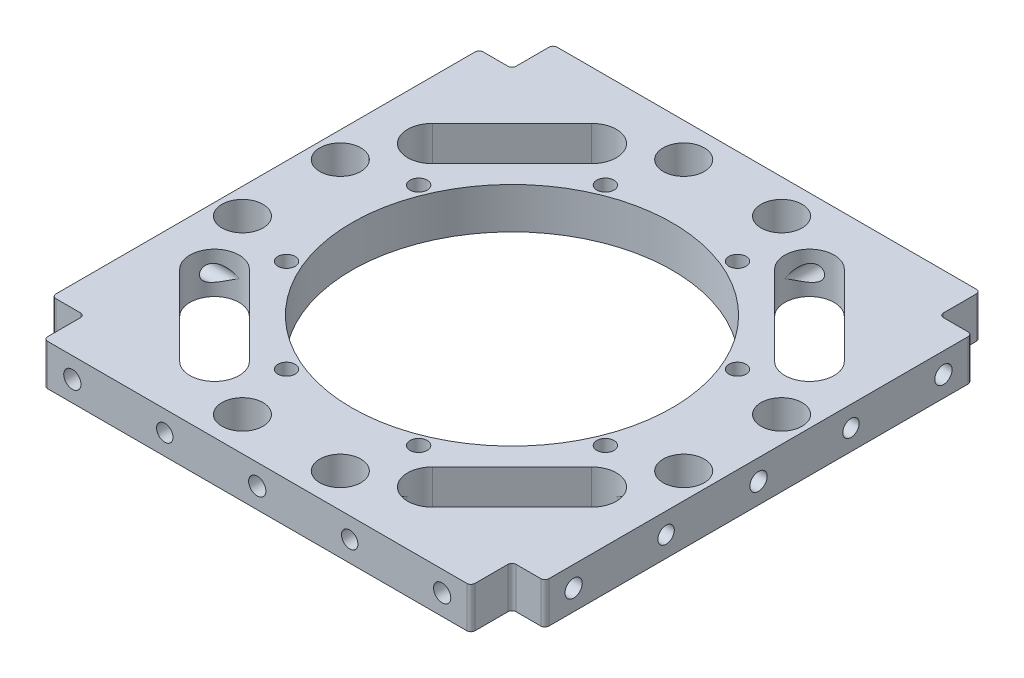
from build123d import *

# Parameters (mm, degrees)
SKETCH_1_W                  = 120
SKETCH_1_H                  = 124
SKETCH_1_R                  = 39
EXTRUDE_1_DEPTH             = 5
SKETCH_2_R                  = 2.1
CUT_EXTRUDE_1_DEPTH         = 87.856203002
PATTERN_CIRCULAR_1_COUNT    = 8
SKETCH_3_R                  = 1.5
CUT_EXTRUDE_2_DEPTH         = 15
SKETCH_4_R                  = 1.5
CUT_EXTRUDE_5_DEPTH         = 10
HOLE_WIZARD_M5_1_AT_2_COUNT = 2
HOLE_WIZARD_M5_1_AT_2_PITCH = 45
HOLE_WIZARD_M5_1_AT_3_COUNT = 2
HOLE_WIZARD_M5_1_AT_3_PITCH = 90
HOLE_WIZARD_M5_2_AT_2_COUNT = 2
HOLE_WIZARD_M5_2_AT_2_PITCH = 45
HOLE_WIZARD_M5_2_AT_3_COUNT = 2
HOLE_WIZARD_M5_2_AT_3_PITCH = 90
SKETCH_10_W                 = 8
SKETCH_10_H                 = 10
CUT_EXTRUDE_6_DEPTH         = 87.856203002
HOLE_WIZARD_M5_3_D          = 4.2
CUT_EXTRUDE_7_DEPTH         = 87.856203002
PATTERN_CIRCULAR_2_COUNT    = 4
SKETCH_13_R                 = 5
CUT_EXTRUDE_8_DEPTH         = 87.856203002
PATTERN_CIRCULAR_3_COUNT    = 4
FILLET_1_R                  = 1
F_4_0MM_1_REACH             = 137.163
F_4_0MM_1_BORE_R            = 2
F_4_0MM_START               = -62
F_4_0MM_2_OUTLINE_R         = 2
F_4_0MM_2_DEPTH             = 16.100653699


# Read off the part's stored shape, not the designer's step: Ø4.0mm 暗销孔2
with BuildPart() as part:
    # 草图1 → 凸台-拉伸1 (new, symmetric)
    with BuildSketch(Plane(origin=(0, 0, 0), x_dir=(1, 0, 0), z_dir=(0, 1, 0))):
        Rectangle(SKETCH_1_W, SKETCH_1_H)
        with Locations(Location((0, 0, 0), (0, 0, 270))):
            Circle(SKETCH_1_R, mode=Mode.SUBTRACT)
    extrude(amount=EXTRUDE_1_DEPTH, both=True)

    # 草图2 → 切除-拉伸1 (cut, through all)
    with BuildSketch(Plane(origin=(0, 5, 0), x_dir=(1, 0, 0), z_dir=(0, 1, 0))):
        with Locations(Location((-16.072704159, 38.802940365, 0), (0, 0, 270))):
            Circle(SKETCH_2_R)
    cut_extrude_1 = extrude(amount=-CUT_EXTRUDE_1_DEPTH, mode=Mode.SUBTRACT)

    # 阵列(圆周)1: 切除-拉伸1 ×8 about axis
    pattern_circular_1_axis = Axis((0, 0, 0), (0, 1, 0))
    for i in range(1, PATTERN_CIRCULAR_1_COUNT):
        add(cut_extrude_1.rotate(pattern_circular_1_axis, i * 360 / PATTERN_CIRCULAR_1_COUNT), mode=Mode.SUBTRACT)

    # 草图3 → 切除-拉伸2 (cut)
    with BuildSketch(Plane(origin=(60, 0, 0), x_dir=(0, 0, -1), z_dir=(1, 0, 0))):
        with Locations((-45, 0)):
            Circle(SKETCH_3_R)
        Circle(SKETCH_3_R)
        with Locations((45, 0)):
            Circle(SKETCH_3_R)
    cut_extrude_2 = extrude(amount=-CUT_EXTRUDE_2_DEPTH, mode=Mode.SUBTRACT)

    # 草图4 → 切除-拉伸5 (cut)
    with BuildSketch(Plane(origin=(0, 0, -62), x_dir=(-1, 0, 0), z_dir=(0, 0, -1))):
        with Locations((-45, 0)):
            Circle(SKETCH_4_R)
        Circle(SKETCH_4_R)
        with Locations((45, 0)):
            Circle(SKETCH_4_R)
    cut_extrude_5 = extrude(amount=-CUT_EXTRUDE_5_DEPTH, mode=Mode.SUBTRACT)

    # 草图7 → M5 螺纹孔1 (revolve, cut)
    with BuildSketch(Plane(origin=(60, 0, -45), x_dir=(0, 0, -1), z_dir=(0, 1, 0))):
        Polygon((0, 0), (0, 18.6618073), (2.1, 17.4), (2.1, 0), align=None)
    hole_wizard_m5_1 = revolve(axis=Axis((66.35, 0, -45), (-1, 0, 0)), mode=Mode.SUBTRACT)

    # M5 螺纹孔1 at 2: M5 螺纹孔1 ×2
    with Locations(*[(0, 0, i * HOLE_WIZARD_M5_1_AT_2_PITCH) for i in range(1, HOLE_WIZARD_M5_1_AT_2_COUNT)]):
        add(hole_wizard_m5_1, mode=Mode.SUBTRACT)

    # M5 螺纹孔1 at 3: M5 螺纹孔1 ×2
    with Locations(*[(0, 0, i * HOLE_WIZARD_M5_1_AT_3_PITCH) for i in range(1, HOLE_WIZARD_M5_1_AT_3_COUNT)]):
        add(hole_wizard_m5_1, mode=Mode.SUBTRACT)

    # 草图9 → M5 螺纹孔2 (revolve, cut)
    with BuildSketch(Plane(origin=(45, 0, -62), x_dir=(0, 1, 0), z_dir=(1, 0, 0))):
        Polygon((0, 0), (0, 13.6618073), (2.1, 12.4), (2.1, 0), align=None)
    hole_wizard_m5_2 = revolve(axis=Axis((45, 0, -68.35), (0, 0, 1)), mode=Mode.SUBTRACT)

    # M5 螺纹孔2 at 2: M5 螺纹孔2 ×2
    with Locations(*[(-i * HOLE_WIZARD_M5_2_AT_2_PITCH, 0, 0) for i in range(1, HOLE_WIZARD_M5_2_AT_2_COUNT)]):
        add(hole_wizard_m5_2, mode=Mode.SUBTRACT)

    # M5 螺纹孔2 at 3: M5 螺纹孔2 ×2
    with Locations(*[(-i * HOLE_WIZARD_M5_2_AT_3_PITCH, 0, 0) for i in range(1, HOLE_WIZARD_M5_2_AT_3_COUNT)]):
        add(hole_wizard_m5_2, mode=Mode.SUBTRACT)

    # 镜向1: 切除-拉伸2, M5 螺纹孔1 across plane
    add(cut_extrude_2.mirror(Plane(origin=(0, 0, 0), x_dir=(0, 0, 1), z_dir=(1, 0, 0))), mode=Mode.SUBTRACT)
    add(hole_wizard_m5_1.mirror(Plane(origin=(0, 0, 0), x_dir=(0, 0, 1), z_dir=(1, 0, 0))), mode=Mode.SUBTRACT)

    # 镜向1 copy 1 sketch → 镜向1 copy 1 (revolve, cut)
    with BuildSketch(Plane(origin=(-60, 0, 0), x_dir=(0, 0, -1), z_dir=(0, 1, 0))):
        Polygon((0, 0), (0, -18.6618073), (2.1, -17.4), (2.1, 0), align=None)
    revolve(axis=Axis((-66.35, 0, 0), (-1, 0, 0)), mode=Mode.SUBTRACT)

    # 镜向1 copy 2 sketch → 镜向1 copy 2 (revolve, cut)
    with BuildSketch(Plane(origin=(-60, 0, 45), x_dir=(0, 0, -1), z_dir=(0, 1, 0))):
        Polygon((0, 0), (0, -18.6618073), (2.1, -17.4), (2.1, 0), align=None)
    revolve(axis=Axis((-66.35, 0, 45), (-1, 0, 0)), mode=Mode.SUBTRACT)

    # 镜向2: 切除-拉伸5, M5 螺纹孔2 across plane
    add(cut_extrude_5.mirror(Plane.XY), mode=Mode.SUBTRACT)
    add(hole_wizard_m5_2.mirror(Plane.XY), mode=Mode.SUBTRACT)

    # 镜向2 copy 1 sketch → 镜向2 copy 1 (revolve, cut)
    with BuildSketch(Plane(origin=(0, 0, 62), x_dir=(0, 1, 0), z_dir=(1, 0, 0))):
        Polygon((0, 0), (0, -13.6618073), (2.1, -12.4), (2.1, 0), align=None)
    revolve(axis=Axis((0, 0, 68.35), (0, 0, 1)), mode=Mode.SUBTRACT)

    # 镜向2 copy 2 sketch → 镜向2 copy 2 (revolve, cut)
    with BuildSketch(Plane(origin=(-45, 0, 62), x_dir=(0, 1, 0), z_dir=(1, 0, 0))):
        Polygon((0, 0), (0, -13.6618073), (2.1, -12.4), (2.1, 0), align=None)
    revolve(axis=Axis((-45, 0, 68.35), (0, 0, 1)), mode=Mode.SUBTRACT)

    # 草图10 → 切除-拉伸6 (cut, through all)
    with BuildSketch(Plane.XZ.offset(5)):
        with Locations((-56, 57)):
            Rectangle(SKETCH_10_W, SKETCH_10_H)
        with Locations((56, 57)):
            Rectangle(SKETCH_10_W, SKETCH_10_H)
        with Locations((56, -57)):
            Rectangle(SKETCH_10_W, SKETCH_10_H)
        with Locations((-56, -57)):
            Rectangle(SKETCH_10_W, SKETCH_10_H)
    extrude(amount=-CUT_EXTRUDE_6_DEPTH, mode=Mode.SUBTRACT)

    # M5 螺纹孔3 (through all)
    with Locations(Plane(origin=(16.072704159, 5, -38.802940365), x_dir=(0, 0, 1), z_dir=(0, 1, 0))):
        with Locations((0, 0), (22.730236206, 22.730236206), (54.875644524, 22.730236206), (77.60588073, 0), (77.60588073, -32.145408318), (54.875644524, -54.875644524), (22.730236206, -54.875644524), (0, -32.145408318)):
            Hole(HOLE_WIZARD_M5_3_D / 2)

    # 草图12 → 切除-拉伸7 (cut, through all)
    with BuildSketch(Plane.XZ.offset(5)):
        with BuildLine():
            Line((22.257359313, -41.656705713), (41.656705713, -22.257359313))
            ThreePointArc((41.656705713, -22.257359313), (50.141987088, -22.257359313), (50.141987088, -30.742640687))
            Line((50.141987088, -30.742640687), (30.742640687, -50.141987088))
            ThreePointArc((30.742640687, -50.141987088), (22.257359313, -50.141987088), (22.257359313, -41.656705713))
        make_face()
    cut_extrude_7 = extrude(amount=-CUT_EXTRUDE_7_DEPTH, mode=Mode.SUBTRACT)

    # 阵列(圆周)2: 切除-拉伸7 ×4 about axis
    pattern_circular_2_axis = Axis((0, 0, 0), (0, 1, 0))
    for i in range(1, PATTERN_CIRCULAR_2_COUNT):
        add(cut_extrude_7.rotate(pattern_circular_2_axis, i * 360 / PATTERN_CIRCULAR_2_COUNT), mode=Mode.SUBTRACT)

    # 草图13 → 切除-拉伸8 (cut, through all)
    with BuildSketch(Plane.XZ.offset(5)):
        with Locations(Location((11.904178767, 53.696280392, 0), (0, 0, 270))):
            Circle(SKETCH_13_R)
        with Locations(Location((-11.904178767, 53.696280392, 0), (0, 0, 270))):
            Circle(SKETCH_13_R)
    cut_extrude_8 = extrude(amount=-CUT_EXTRUDE_8_DEPTH, mode=Mode.SUBTRACT)

    # 阵列(圆周)3: 切除-拉伸8 ×4 about axis
    pattern_circular_3_axis = Axis((0, 0, 0), (0, 1, 0))
    for i in range(1, PATTERN_CIRCULAR_3_COUNT):
        add(cut_extrude_8.rotate(pattern_circular_3_axis, i * 360 / PATTERN_CIRCULAR_3_COUNT), mode=Mode.SUBTRACT)

    # 圆角1
    fillet_1_edges = [part.edges().sort_by_distance(p)[0] for p in [
        (-60, 0, -52),
        (-52, 0, -52),
        (-52, 0, -62),
        (60, 0, -52),
        (52, 0, -62),
        (52, 0, -52),
        (60, 0, 52),
        (52, 0, 52),
        (52, 0, 62),
        (-60, 0, 52),
        (-52, 0, 62),
        (-52, 0, 52),
    ]]
    fillet(fillet_1_edges, radius=FILLET_1_R)

    # Ø4.0mm 暗销孔1 bore → Ø4.0mm 暗销孔1 (cut, up to next)
    with BuildSketch(Plane.ZY.offset(60), mode=Mode.PRIVATE) as f_4_0mm_1_sk1:
        with Locations((-22.5, 0)):
            Circle(F_4_0MM_1_BORE_R)
    f_4_0mm_1_tool1 = extrude(f_4_0mm_1_sk1.sketch, amount=-F_4_0MM_1_REACH, mode=Mode.PRIVATE) & part.part
    # Ø4.0mm 暗销孔1 bore → Ø4.0mm 暗销孔1 (cut, up to next)
    with BuildSketch(Plane.ZY.offset(60), mode=Mode.PRIVATE) as f_4_0mm_1_sk2:
        with Locations((22.5, 0)):
            Circle(F_4_0MM_1_BORE_R)
    f_4_0mm_1_tool2 = extrude(f_4_0mm_1_sk2.sketch, amount=-F_4_0MM_1_REACH, mode=Mode.PRIVATE) & part.part
    f_4_0mm_1_1 = f_4_0mm_1_tool1.solids().sort_by_distance((-60, 0, -22.5))[0]
    add(f_4_0mm_1_1, mode=Mode.SUBTRACT)
    f_4_0mm_1_2 = f_4_0mm_1_tool2.solids().sort_by_distance((-60, 0, 22.5))[0]
    add(f_4_0mm_1_2, mode=Mode.SUBTRACT)
    f_4_0mm_1 = f_4_0mm_1_1 + f_4_0mm_1_2  # Ø4.0mm 暗销孔1 as one shape, for the pattern or mirror that repeats it

    # 镜向3: Ø4.0mm 暗销孔1 across plane
    add(f_4_0mm_1.mirror(Plane(origin=(0, 0, 0), x_dir=(0, 0, 1), z_dir=(1, 0, 0))), mode=Mode.SUBTRACT)

    # Ø4.0mm 暗销孔2 outline → Ø4.0mm 暗销孔2 (cut)
    with BuildSketch(Plane.XY.offset(F_4_0MM_START)):
        with Locations((-22.5, 0)):
            Circle(F_4_0MM_2_OUTLINE_R)
        with Locations((22.5, 0)):
            Circle(F_4_0MM_2_OUTLINE_R)
    f_4_0mm_2 = extrude(amount=F_4_0MM_2_DEPTH, mode=Mode.SUBTRACT)

    # 镜向4: Ø4.0mm 暗销孔2 across plane
    add(f_4_0mm_2.mirror(Plane.XY), mode=Mode.SUBTRACT)


solid = part.part
